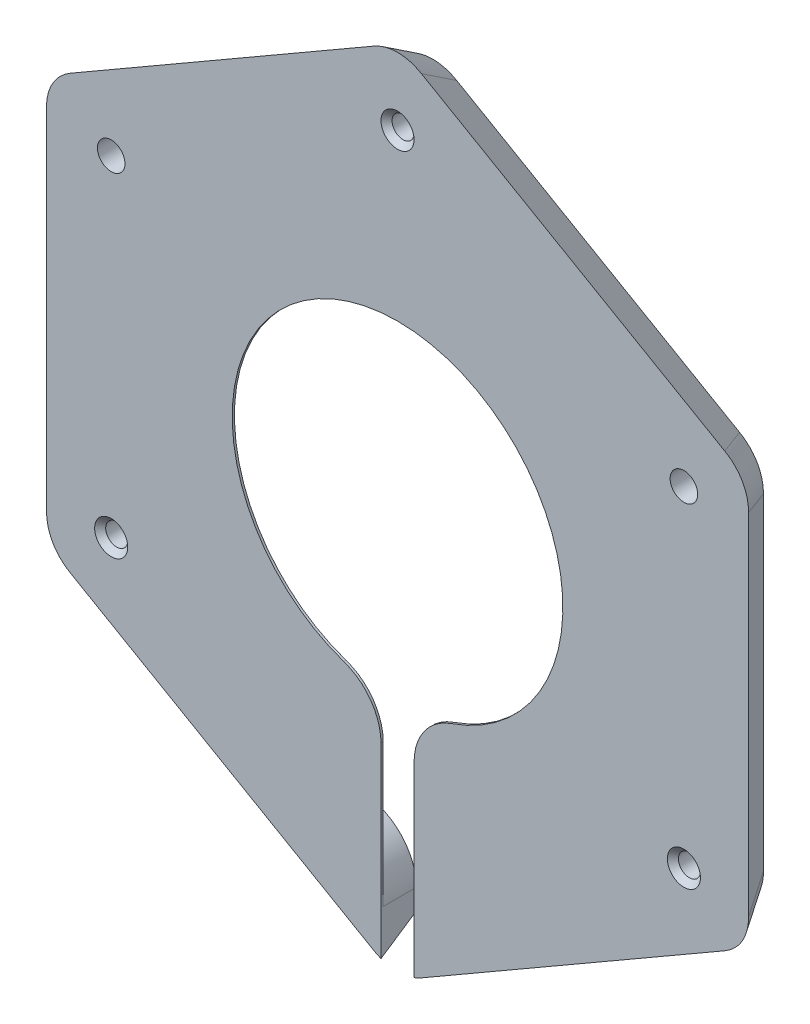
from build123d import *

# Parameters (mm, degrees)
BOSS_EXTRUDE1_DEPTH       = 6.4
BOSS_EXTRUDE1_DRAFT       = -30
FILLET1_R                 = 10
SKETCH13_R                = 2
CUT_EXTRUDE3_DEPTH        = 5
SKETCH14_R                = 1.5
CUT_EXTRUDE4_DEPTH        = 97.51813456
SKETCH15_R                = 55
CUT_EXTRUDE5_DEPTH        = 6
CIRPATTERN9_COUNT         = 3
BOSS_EXTRUDE4_DEPTH       = 6
SKETCH21_W                = 4
SKETCH21_H                = 2
FILLET8_R                 = 1
CIRPATTERN11_COUNT        = 3
CIRPATTERN11_ANGLE        = 120
FILLET8_OF_CIRPATTERN11_R = 1
SKETCH16_R                = 2.5
CUT_EXTRUDE6_DEPTH        = 97.51813456
CIRPATTERN10_COUNT        = 3
CUT_EXTRUDE7_DEPTH        = 97.51813456
FILLET9_R                 = 10
FILLET10_R                = 3
CHAMFER2_SIZE             = 1


with BuildPart() as part:
    # Sketch1 → Boss-Extrude1 (with draft: the straight prism first)
    with BuildSketch(Plane.XY):
        Polygon((0, 69.282032303), (-60, 34.641016151), (-60, -34.641016151), (0, -69.282032303), (60, -34.641016151), (60, 34.641016151), align=None)
    extrude(amount=BOSS_EXTRUDE1_DEPTH)
    # Boss-Extrude1: the draft: its side faces are tilted about the plane it starts from
    boss_extrude1_sides = [part.faces().sort_by_distance(p)[0] for p in [
        (-30, 51.961524227, 3.2),
        (-60, 0, 3.2),
        (-30, -51.961524227, 3.2),
        (30, -51.961524227, 3.2),
        (60, 0, 3.2),
        (30, 51.961524227, 3.2),
    ]]
    draft(boss_extrude1_sides, Plane.XY, BOSS_EXTRUDE1_DRAFT)

    # Fillet1
    fillet1_edges = [part.edges().sort_by_distance(p)[0] for p in [
        (61.847520861, 35.707682818, 3.2),
        (61.847520861, -35.707682818, 3.2),
        (0, -71.415365636, 3.2),
        (-61.847520861, -35.707682818, 3.2),
        (-61.847520861, 35.707682818, 3.2),
        (0, 71.415365636, 3.2),
    ]]
    fillet(fillet1_edges, radius=FILLET1_R)

    # Sketch13 → Cut-Extrude3 (cut)
    with BuildSketch(Plane.XY.offset(6.4)):
        with Locations((0, 60)):
            Circle(SKETCH13_R)
    cut_extrude3 = extrude(amount=-CUT_EXTRUDE3_DEPTH, mode=Mode.SUBTRACT)

    # Sketch14 → Cut-Extrude4 (cut, through all)
    with BuildSketch(Plane(origin=(0, 0, 0), x_dir=(-1, 0, 0), z_dir=(0, 0, -1))):
        with Locations((0, 60)):
            Circle(SKETCH14_R)
    cut_extrude4 = extrude(amount=-CUT_EXTRUDE4_DEPTH, mode=Mode.SUBTRACT)

    # Sketch15 → Cut-Extrude5 (cut)
    with BuildSketch(Plane(origin=(0, 0, 0), x_dir=(-1, 0, 0), z_dir=(0, 0, -1))):
        Circle(SKETCH15_R)
    extrude(amount=-CUT_EXTRUDE5_DEPTH, mode=Mode.SUBTRACT)

    # CirPattern9: Cut-Extrude3, Cut-Extrude4 ×3 about axis
    cirpattern9_axis = Axis((0, 0, 0), (0, 0, 1))
    add([cut_extrude3.rotate(cirpattern9_axis, i * 360 / CIRPATTERN9_COUNT) for i in range(1, CIRPATTERN9_COUNT)], mode=Mode.SUBTRACT)
    add([cut_extrude4.rotate(cirpattern9_axis, i * 360 / CIRPATTERN9_COUNT) for i in range(1, CIRPATTERN9_COUNT)], mode=Mode.SUBTRACT)

    # Sketch20 → Boss-Extrude4 (add)
    with BuildSketch(Plane(origin=(0, 0, 6), x_dir=(-1, 0, 0), z_dir=(0, 0, -1))):
        Polygon((-12.082903769, 58), (-4, 44), (4, 44), (12.082903769, 58), align=None)
    boss_extrude4 = extrude(amount=BOSS_EXTRUDE4_DEPTH)

    # Sketch21 → Cut-Revolve1 (revolve, cut)
    with BuildSketch(Plane(origin=(0, 44, 0), x_dir=(-1, 0, 0), z_dir=(0, -1, 0))):
        with Locations((0, -5)):
            Rectangle(SKETCH21_W, SKETCH21_H)
    cut_revolve1 = revolve(axis=Axis((4, 44, 0), (1, 0, 0)), mode=Mode.SUBTRACT)

    # Fillet8
    fillet8_edges = [part.edges().sort_by_distance(p)[0] for p in [
        (0, 48, 0),
    ]]
    fillet(fillet8_edges, radius=FILLET8_R)

    # CirPattern11: Boss-Extrude4, Cut-Revolve1 ×3 about axis
    cirpattern11_axis = Axis((0, 0, 0), (0, 0, -1))
    add([boss_extrude4.rotate(cirpattern11_axis, i * CIRPATTERN11_ANGLE / (CIRPATTERN11_COUNT - 1)) for i in range(1, CIRPATTERN11_COUNT)])
    add([cut_revolve1.rotate(cirpattern11_axis, i * CIRPATTERN11_ANGLE / (CIRPATTERN11_COUNT - 1)) for i in range(1, CIRPATTERN11_COUNT)], mode=Mode.SUBTRACT)

    # Fillet8 of CirPattern11
    fillet8_of_cirpattern11_edges = [part.edges().sort_by_distance(p)[0] for p in [
        (41.569219382, 24, 0),
        (41.569219382, -24, 0),
    ]]
    fillet(fillet8_of_cirpattern11_edges, radius=FILLET8_OF_CIRPATTERN11_R)

    # Sketch16 → Cut-Extrude6 (cut, through all)
    with BuildSketch(Plane(origin=(0, 0, 0), x_dir=(-1, 0, 0), z_dir=(0, 0, -1))):
        with Locations((0, -60)):
            Circle(SKETCH16_R)
    cut_extrude6 = extrude(amount=-CUT_EXTRUDE6_DEPTH, mode=Mode.SUBTRACT)

    # CirPattern10: Cut-Extrude6 ×3 about axis
    cirpattern10_axis = Axis((0, 0, 0), (0, 0, 1))
    for i in range(1, CIRPATTERN10_COUNT):
        add(cut_extrude6.rotate(cirpattern10_axis, i * 360 / CIRPATTERN10_COUNT), mode=Mode.SUBTRACT)

    # Sketch22 → Cut-Extrude7 (cut, through all)
    with BuildSketch(Plane.XY.offset(6.4)):
        with BuildLine():
            Line((-3, -37.828560639), (-3, -80))
            Line((-3, -80), (3, -80))
            Line((3, -80), (3, -37.828560639))
            ThreePointArc((3, -37.828560639), (4.860589702, -32.019085619), (9.75, -28.371420479))
            ThreePointArc((9.75, -28.371420479), (0, 30), (-9.75, -28.371420479))
            ThreePointArc((-9.75, -28.371420479), (-4.860589702, -32.019085619), (-3, -37.828560639))
        make_face()
    extrude(amount=-CUT_EXTRUDE7_DEPTH, mode=Mode.SUBTRACT)

    # Fillet9
    fillet9_edges = [part.edges().sort_by_distance(p)[0] for p in [
        (3, -54.918120871, 3),
        (-3, -54.918120871, 3),
    ]]
    fillet(fillet9_edges, radius=FILLET9_R)

    # Fillet10
    fillet10_edges = [part.edges().sort_by_distance(p)[0] for p in [
        (51.782434001, 18.535898385, 3),
        (41.943775884, 35.576954122, 3),
        (36.105117767, 25.464101615, 3),
        (40.105117767, 18.535898385, 3),
        (41.943775884, -35.576954122, 3),
        (51.782434001, -18.535898385, 3),
        (40.105117767, -18.535898385, 3),
        (36.105117767, -25.464101615, 3),
        (9.838658117, 54.112852507, 3),
        (-9.838658117, 54.112852507, 3),
        (-4, 44, 3),
        (4, 44, 3),
    ]]
    fillet(fillet10_edges, radius=FILLET10_R)

    # Chamfer2
    # the kernel refuses this chamfer: 1 mm, written as the material it takes off along each edge
    with BuildSketch(Plane(origin=(0, 60, 6.4), x_dir=(1, 0, 0), z_dir=(0, -1, 0))) as chamfer2_piece_1:
        Polygon((2 + CHAMFER2_SIZE, 0), (2, -CHAMFER2_SIZE), (2, 0), align=None)
    revolve(axis=Axis((0, 60, 6.4), (0, 0, 1)), mode=Mode.SUBTRACT)
    with BuildSketch(Plane(origin=(51.961524227, -30, 6.4), x_dir=(-0.4999999999999998, -0.8660254037844389, 0), z_dir=(-0.8660254037844389, 0.4999999999999998, 0))) as chamfer2_piece_2:
        Polygon((2 + CHAMFER2_SIZE, 0), (2, -CHAMFER2_SIZE), (2, 0), align=None)
    revolve(axis=Axis((51.961524227, -30, 6.4), (0, 0, 1)), mode=Mode.SUBTRACT)
    with BuildSketch(Plane(origin=(-51.961524227, -30, 6.4), x_dir=(-0.4999999999999998, 0.8660254037844389, 0), z_dir=(0.8660254037844389, 0.4999999999999998, 0))) as chamfer2_piece_3:
        Polygon((2 + CHAMFER2_SIZE, 0), (2, -CHAMFER2_SIZE), (2, 0), align=None)
    revolve(axis=Axis((-51.961524227, -30, 6.4), (0, 0, 1)), mode=Mode.SUBTRACT)


solid = part.part
